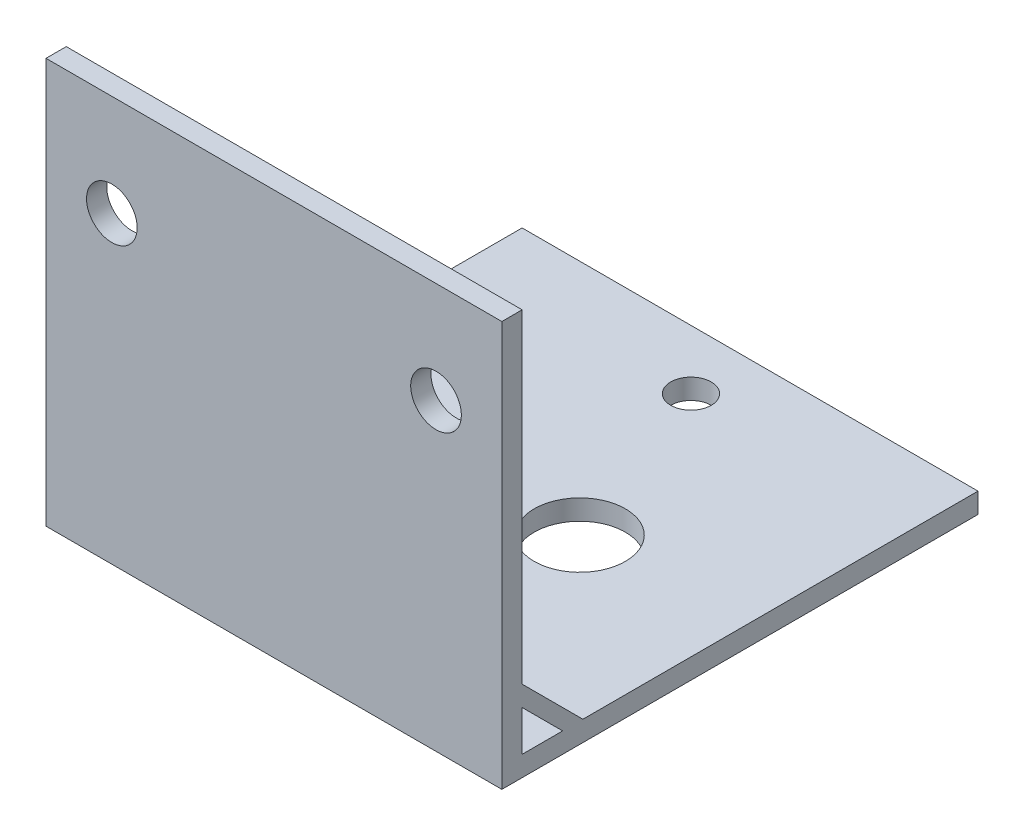
from build123d import *

# Parameters (mm, degrees)
SKETCH7_W           = 45
SKETCH7_H           = 45
SKETCH7_R           = 2
SKETCH7_R_2         = 4.5
BOSS_EXTRUDE5_DEPTH = 2
SKETCH7_3_W         = 45
SKETCH7_3_H         = 2
BOSS_EXTRUDE6_DEPTH = 40
BOSS_EXTRUDE7_DEPTH = 2
SKETCH10_R          = 2.5
CUT_EXTRUDE2_DEPTH  = 2


with BuildPart() as part:
    # Sketch7 → Boss-Extrude5 (new body)
    with BuildSketch(Plane(origin=(0, 0, 0), x_dir=(1, 0, 0), z_dir=(0, 1, 0))):
        with Locations((5.756289545, -118.050969126)):
            Rectangle(SKETCH7_W, SKETCH7_H)
        with Locations((4.759373978, -136.385312035)):
            Circle(SKETCH7_R, mode=Mode.SUBTRACT)
        with Locations((5.756289545, -101.385312035)):
            Circle(SKETCH7_R, mode=Mode.SUBTRACT)
        with Locations((12.361917415, -118.963651523)):
            Circle(SKETCH7_R_2, mode=Mode.SUBTRACT)
    extrude(amount=BOSS_EXTRUDE5_DEPTH)

    # Sketch7<3> → Boss-Extrude6 (add)
    with BuildSketch(Plane(origin=(0, 0, 0), x_dir=(1, 0, 0), z_dir=(0, 1, 0))):
        with Locations((5.756289545, -141.550969126)):
            Rectangle(SKETCH7_3_W, SKETCH7_3_H)
    extrude(amount=BOSS_EXTRUDE6_DEPTH)

    # Sketch8 → Boss-Extrude7 (add)
    with BuildSketch(Plane.ZY.offset(16.743710455)):
        Polygon((140.550969126, 6), (136.550969126, 2), (134.550969126, 2), (140.550969126, 8), align=None)
    boss_extrude7 = extrude(amount=-BOSS_EXTRUDE7_DEPTH)

    # Mirror2: Boss-Extrude7 across plane
    add(boss_extrude7.mirror(Plane.ZY.offset(-5.756289545)))

    # Sketch10 → Cut-Extrude2 (cut)
    with BuildSketch(Plane.XY.offset(142.550969126)):
        with Locations((21.756289545, 30)):
            Circle(SKETCH10_R)
        with Locations((-10.243710455, 30)):
            Circle(SKETCH10_R)
    extrude(amount=-CUT_EXTRUDE2_DEPTH, mode=Mode.SUBTRACT)


solid = part.part
